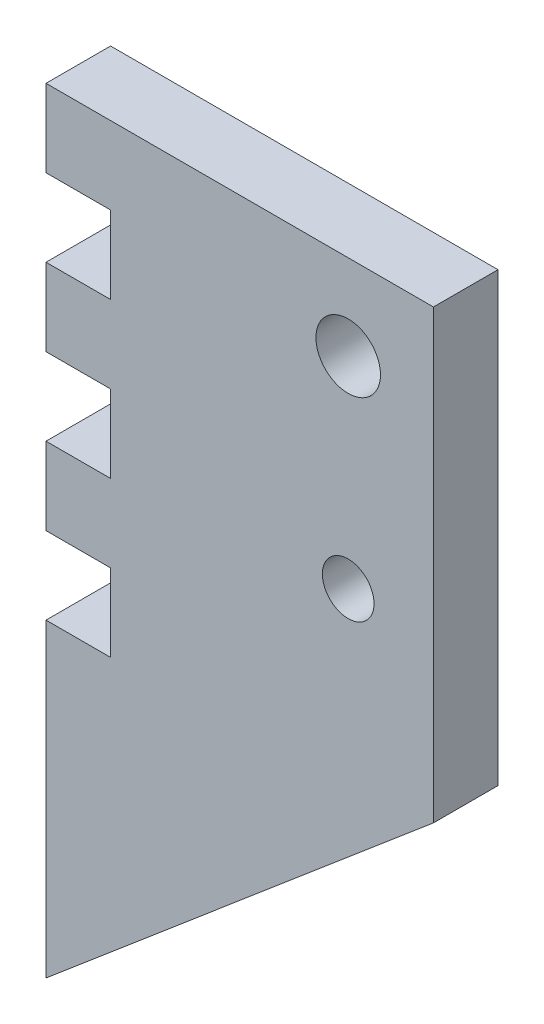
from build123d import *

# Parameters (mm, degrees)
SKETCH1_R           = 2.54
SKETCH1_R_2         = 3.175
BOSS_EXTRUDE1_DEPTH = 6.35


with BuildPart() as part:
    # Sketch1 → Boss-Extrude1 (new body)
    with BuildSketch(Plane.XY):
        Polygon((0, -43.942), (0, 0), (-38.1, 0), (-38.1, -7.62), (-31.75, -7.62), (-31.75, -15.24), (-38.1, -15.24), (-38.1, -22.86), (-31.75, -22.86), (-31.75, -30.48), (-38.1, -30.48), (-38.1, -38.1), (-31.75, -38.1), (-31.75, -45.72), (-38.1, -45.72), (-38.1, -76.2), align=None)
        with Locations((-8.382, -28.194)):
            Circle(SKETCH1_R, mode=Mode.SUBTRACT)
        with Locations((-8.382, -8.382)):
            Circle(SKETCH1_R_2, mode=Mode.SUBTRACT)
    extrude(amount=BOSS_EXTRUDE1_DEPTH)


solid = part.part
